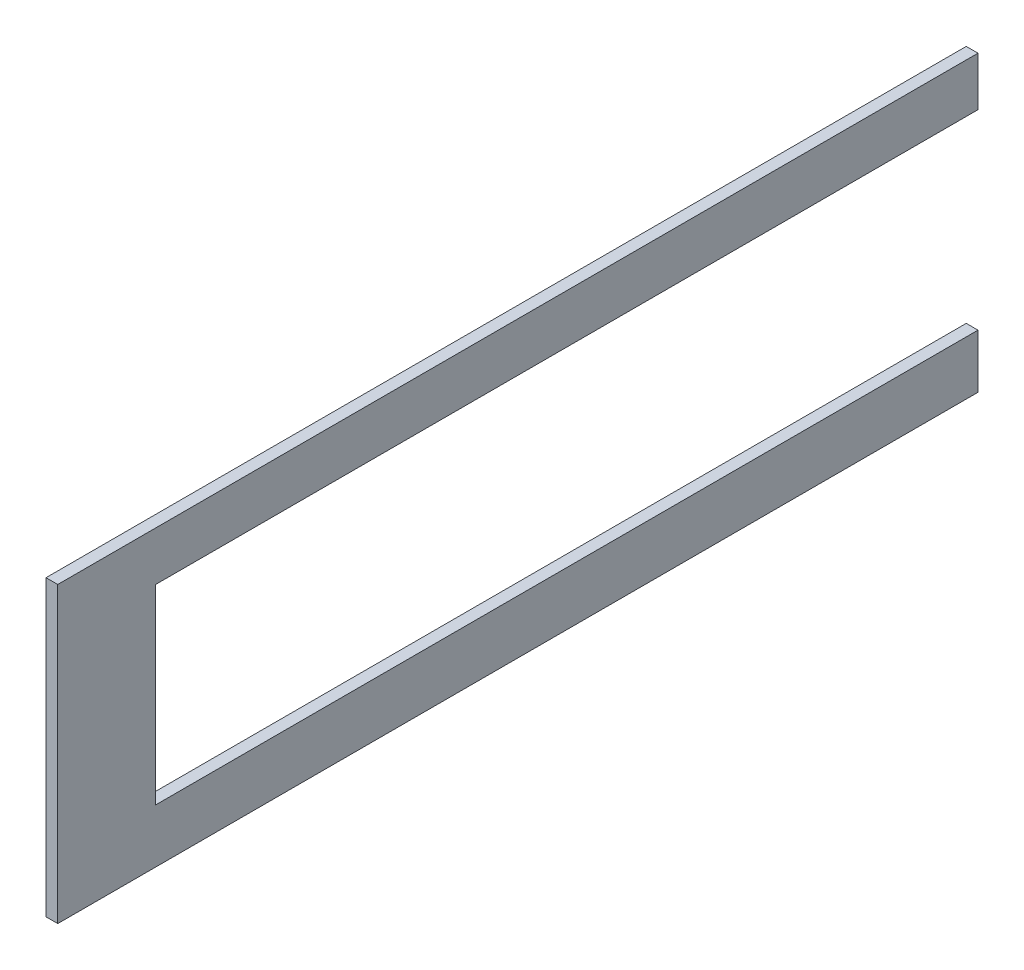
from build123d import *

# Parameters (mm, degrees)
BOSS_EXTRUDE1_DEPTH = 6


with BuildPart() as part:
    # Sketch1 → Boss-Extrude1 (new body)
    with BuildSketch(Plane(origin=(0, 0, 0), x_dir=(0, 0, -1), z_dir=(1, 0, 0))):
        Polygon((470, 125), (470, 150), (0, 150), (0, 0), (470, 0), (470, 27.5), (50, 27.5), (50, 125), align=None)
    extrude(amount=BOSS_EXTRUDE1_DEPTH)


solid = part.part
